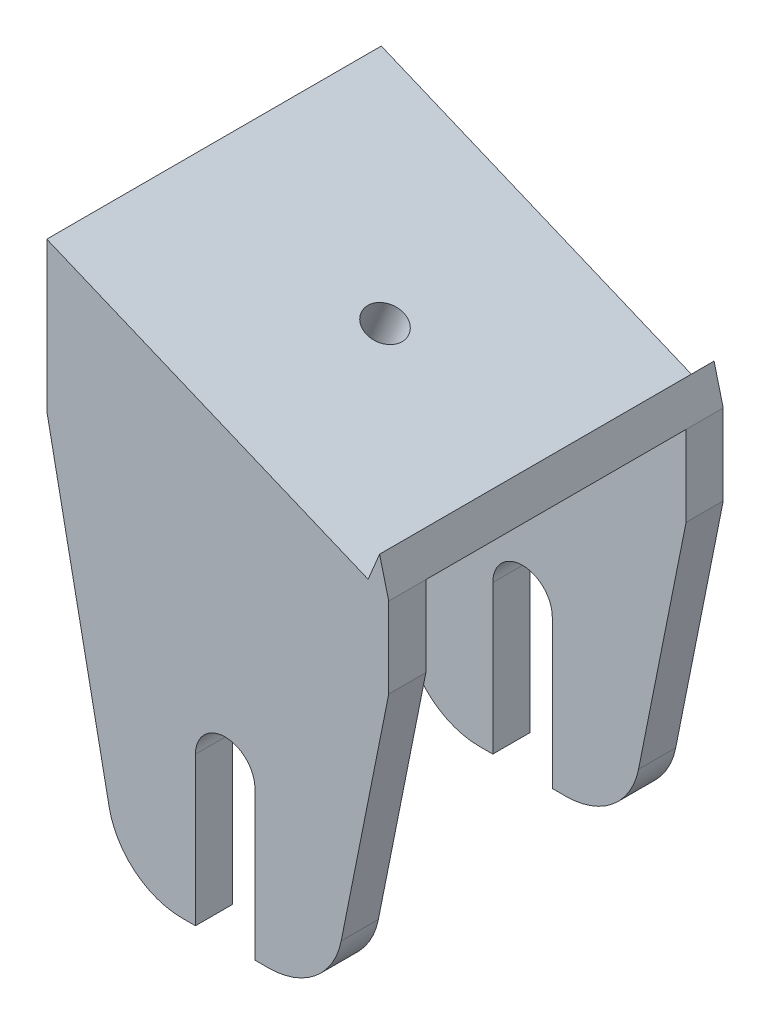
from build123d import *

# Parameters (mm, degrees)
SALIENTE_EXTRUIR1_DEPTH      = 45
CORTAR_EXTRUIR1_DEPTH        = 35
CORTAR_EXTRUIR1_DEPTH_BACK   = 25
SALIENTE_EXTRUIR2_DEPTH      = 0.0001
SALIENTE_EXTRUIR2_DEPTH_BACK = 10
CORTAR_EXTRUIR2_DEPTH        = 50.0001
CROQUIS5_R                   = 2.5
CORTAR_EXTRUIR3_DEPTH        = 20
CROQUIS6_W                   = 35
CROQUIS6_H                   = 5
CORTAR_EXTRUIR4_DEPTH        = 50
REDONDEO7_R                  = 10
SALIENTE_EXTRUIR3_DEPTH      = 45


with BuildPart() as part:
    # Croquis1 → Saliente-Extruir1 (new body)
    with BuildSketch(Plane.XY):
        with BuildLine():
            Line((5.169872345, 17.452931937), (-42.830127655, 37.452931937))
            Line((-42.830127655, 37.452931937), (-42.830127655, 17.452931937))
            Line((-42.830127655, 17.452931937), (-34.437895384, -24.508229414))
            ThreePointArc((-34.437895384, -24.508229414), (-30.971977683, -30.280489476), (-24.632088627, -32.547068063))
            Line((-24.632088627, -32.547068063), (-22.830127655, -32.547068063))
            Line((-22.830127655, -32.547068063), (-22.830127655, -12.547068063))
            ThreePointArc((-22.830127655, -12.547068063), (-18.830127655, -8.547068063), (-14.830127655, -12.547068063))
            Line((-14.830127655, -12.547068063), (-14.830127655, -32.547068063))
            Line((-14.830127655, -32.547068063), (-13.028166682, -32.547068063))
            ThreePointArc((-13.028166682, -32.547068063), (-6.688277626, -30.280489476), (-3.222359925, -24.508229414))
            Line((-3.222359925, -24.508229414), (5.169872345, 17.452931937))
        make_face()
    extrude(amount=SALIENTE_EXTRUIR1_DEPTH)

    # Croquis2 → Cortar-Extruir1 (cut, two sides: drawn at the far end of the back side and taken through both)
    with BuildSketch(Plane(origin=(-22.830127655, 0, 0), x_dir=(0, 0, -1), z_dir=(1, 0, 0)).offset(-CORTAR_EXTRUIR1_DEPTH_BACK)):
        Polygon((-40, -32.547068063), (-5, -32.547068063), (-5, 11.74295153), (-5, 27.452931937), (-40, 27.382795607), (-40, 11.74295153), align=None)
    extrude(amount=CORTAR_EXTRUIR1_DEPTH + CORTAR_EXTRUIR1_DEPTH_BACK, mode=Mode.SUBTRACT)

    # Croquis3 → Saliente-Extruir2 (add, two sides: drawn at the far end of the back side and taken through both)
    with BuildSketch(Plane(origin=(6.961081212, 16.706594909, 0), x_dir=(0.9230769230769231, -0.38461538461538447, 0), z_dir=(0.38461538461538447, 0.9230769230769231, 0)).offset(-SALIENTE_EXTRUIR2_DEPTH_BACK)):
        Polygon((-53.940476272, -45), (-53.940476272, 0), (-1.940476272, 0), (5.740404043, 0), (5.740404043, -45), (-1.940476272, -45), align=None)
    extrude(amount=SALIENTE_EXTRUIR2_DEPTH + SALIENTE_EXTRUIR2_DEPTH_BACK)

    # Croquis4 → Cortar-Extruir2 (cut)
    with BuildSketch(Plane.XY.offset(45)):
        Polygon((-42.830127655, 17.452931937), (-42.830127655, 41.659540507), (3.169872345, 41.659540507), (3.169872345, 7.452931937), (4.911234771, 4.934595431), (17.135740174, 1.881036512), (16.246125069, 53.47871262), (-56.321049949, 53.47871262), (-56.321049949, 17.452931937), align=None)
    extrude(amount=-CORTAR_EXTRUIR2_DEPTH, mode=Mode.SUBTRACT)

    # Croquis5 → Cortar-Extruir3 (cut)
    with BuildSketch(Plane(origin=(6.961119674, 16.706687217, 0), x_dir=(0.9230769230769231, -0.3846153846153847, 0), z_dir=(0.38461538461538464, 0.923076923076923, 0))):
        with Locations(Location((-29.023830439, -22.5, 0), (0, 0, 180))):
            Circle(CROQUIS5_R)
    extrude(amount=-CORTAR_EXTRUIR3_DEPTH, mode=Mode.SUBTRACT)

    # Croquis6 → Cortar-Extruir4 (cut)
    with BuildSketch(Plane(origin=(3.169872345, 0, 0), x_dir=(0, 0, -1), z_dir=(1, 0, 0))):
        with Locations((-22.5, 9.952931937)):
            Rectangle(CROQUIS6_W, CROQUIS6_H)
    extrude(amount=-CORTAR_EXTRUIR4_DEPTH, mode=Mode.SUBTRACT)

    # Redondeo7
    # the kernel refuses this fillet: 10 mm, written as the material it takes off along each edge
    with BuildSketch(Plane(origin=(3.169872345, 12.452931937, 40), x_dir=(-1, 0, 0), z_dir=(0, 0, -1))) as redondeo7_piece_1:
        with BuildLine():
            CenterArc((REDONDEO7_R, REDONDEO7_R), REDONDEO7_R, 180, 90)
            Line((0, REDONDEO7_R), (0, 0))
            Line((0, 0), (REDONDEO7_R, 0))
        make_face()
    extrude(amount=35, mode=Mode.SUBTRACT)

    # Croquis7 → Saliente-Extruir3 (add)
    with BuildSketch(Plane.XY.offset(45)):
        Polygon((0.400641576, 19.440219758), (1.939103115, 23.13252745), (3.169872345, 18.286373604), align=None)
    extrude(amount=-SALIENTE_EXTRUIR3_DEPTH)


solid = part.part
